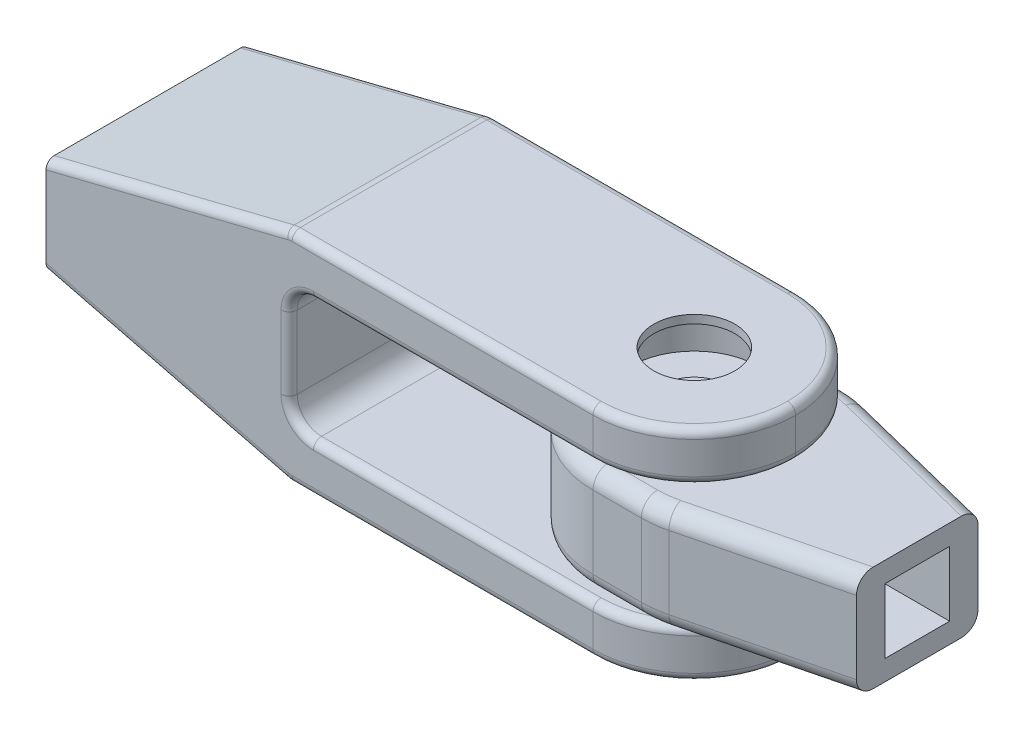
from build123d import *
from build123d.topology import SkipClean

# Parameters (mm, degrees)
BOSS_EXTRUDE1_DEPTH     = 12.5
FILLET1_R               = 12.5
FILLET2_R               = 3
SKETCH2_W               = 8
SKETCH2_H               = 8
CUT_EXTRUDE1_DEPTH      = 20
SKETCH3_R               = 7.9375
CUT_EXTRUDE2_DEPTH      = 12.47904
CUT_EXTRUDE3_DEPTH      = 54.27757502
CUT_EXTRUDE3_DEPTH_BACK = 54.27757502
SKETCH4_R               = 5
SKETCH5_W               = 40
SKETCH5_H               = 13
BOSS_EXTRUDE2_DEPTH     = 12.5
FILLET4_R               = 12.5
CUT_EXTRUDE4_DEPTH      = 70.14658343
CUT_EXTRUDE4_DEPTH_BACK = 70.14658343
SKETCH7_R               = 2.5
SKETCH9_W               = 8
SKETCH9_H               = 8
CUT_EXTRUDE5_DEPTH      = 20
SKETCH10_R              = 4
SKETCH10_R_2            = 2.5
BOSS_EXTRUDE3_DEPTH     = 7.5
FILLET5_R               = 12.5
FILLET6_R               = 2
FILLET3_R               = 1


with BuildPart() as part:
    # Sketch1 → Boss-Extrude1 (new, symmetric)
    with BuildSketch(Plane.XY):
        Polygon((0, 13.5), (50, 13.5), (50, 7.5), (0, 7.5), (0, -7.5), (50, -7.5), (50, -13.5), (0, -13.5), (-30, -6), (-30, 6), align=None)
    extrude(amount=BOSS_EXTRUDE1_DEPTH, both=True)

    # Fillet1
    fillet1_edges = [part.edges().sort_by_distance(p)[0] for p in [
        (50, -10.5, -12.5),
        (50, -10.5, 12.5),
        (50, 10.5, -12.5),
        (50, 10.5, 12.5),
    ]]
    fillet(fillet1_edges, radius=FILLET1_R - 0.0001)  # a hair under: the kernel refuses the full size

    # Fillet2
    fillet2_edges = [part.edges().sort_by_distance(p)[0] for p in [
        (0, -13.5, 0),
        (0, -7.5, 0),
        (0, 7.5, 0),
        (0, 13.5, 0),
    ]]
    fillet(fillet2_edges, radius=FILLET2_R)

    # Sketch2 → Cut-Extrude1 (cut)
    with BuildSketch(Plane.ZY.offset(30)):
        Rectangle(SKETCH2_W, SKETCH2_H)
    extrude(amount=-CUT_EXTRUDE1_DEPTH, mode=Mode.SUBTRACT)

    # Sketch3 → Cut-Extrude2 (cut, symmetric)
    with BuildSketch(Plane(origin=(0, 0, 0), x_dir=(1, 0, 0), z_dir=(0, 1, 0))):
        with Locations(Location((37.5, 0, 0), (0, 0, 270))):
            Circle(SKETCH3_R)
    extrude(amount=CUT_EXTRUDE2_DEPTH, both=True, mode=Mode.SUBTRACT)

    # Sketch4 → Cut-Extrude3 (cut, two sides: drawn at the far end of the back side and taken through both)
    with BuildSketch(Plane(origin=(0, 0, 0), x_dir=(1, 0, 0), z_dir=(0, 1, 0)).offset(-CUT_EXTRUDE3_DEPTH_BACK)):
        with Locations(Location((37.5, 0, 0), (0, 0, 270))):
            Circle(SKETCH4_R)
    extrude(amount=CUT_EXTRUDE3_DEPTH + CUT_EXTRUDE3_DEPTH_BACK, mode=Mode.SUBTRACT)

    # Fillet3
    fillet3_edges = [part.edges().sort_by_distance(p)[0] for p in [
        (-15.179144999, 9.70521375, -12.5),
        (20.25005, 7.5, -12.5),
        (18.934708438, -13.5, -12.5),
        (18.934708438, -13.5, 12.5),
        (46.338864054, -13.5, 8.838864054),
        (46.338864054, -13.5, -8.838864054),
        (46.338864054, -7.5, 8.838864054),
        (46.338864054, -7.5, -8.838864054),
        (20.25005, 7.5, 12.5),
        (46.338864054, 7.5, 8.838864054),
        (46.338864054, 7.5, -8.838864054),
        (46.338864054, 13.5, 8.838864054),
        (46.338864054, 13.5, -8.838864054),
        (20.25005, -7.5, -12.5),
        (-15.179144999, -9.70521375, -12.5),
        (18.934708438, 13.5, -12.5),
        (0, 0, -12.5),
        (0.002767086, 13.47752267, -12.5),
        (0.002767086, -13.47752267, -12.5),
        (-15.179144999, -9.70521375, 12.5),
        (20.25005, -7.5, 12.5),
        (0, 0, 12.5),
        (18.934708438, 13.5, 12.5),
        (0.002767086, 13.47752267, 12.5),
        (0.002767086, -13.47752267, 12.5),
        (0.878679656, -6.621320344, -12.5),
        (0.878679656, -6.621320344, 12.5),
        (0.878679656, 6.621320344, -12.5),
        (0.878679656, 6.621320344, 12.5),
        (-15.179144999, 9.70521375, 12.5),
    ]]
    fillet(fillet3_edges, radius=FILLET3_R)


with BuildPart() as body_2:
    # Sketch5 → Boss-Extrude2 (new, symmetric)
    with BuildSketch(Plane.XY):
        with Locations((45, 0)):
            Rectangle(SKETCH5_W, SKETCH5_H)
    extrude(amount=BOSS_EXTRUDE2_DEPTH, both=True)

    # Fillet4
    fillet4_edges = [body_2.edges().sort_by_distance(p)[0] for p in [
        (25, 0, 12.5),
        (25, 0, -12.5),
    ]]
    fillet(fillet4_edges, radius=FILLET4_R - 0.0001)  # a hair under: the kernel refuses the full size

    # Sketch7 → Cut-Extrude4 (cut, two sides: drawn at the far end of the back side and taken through both)
    with BuildSketch(Plane(origin=(0, 6.5, 0), x_dir=(1, 0, 0), z_dir=(0, 1, 0)).offset(-CUT_EXTRUDE4_DEPTH_BACK)):
        with Locations(Location((37.5, 0, 0), (0, 0, 270))):
            Circle(SKETCH7_R)
        Polygon((45, 12.5), (65, 7.5), (65, 12.5), align=None)
        Polygon((65, -7.5), (65, -12.5), (45, -12.5), align=None)
    extrude(amount=CUT_EXTRUDE4_DEPTH + CUT_EXTRUDE4_DEPTH_BACK, mode=Mode.SUBTRACT)

    # Sketch9 → Cut-Extrude5 (cut)
    with BuildSketch(Plane(origin=(65, 0, 0), x_dir=(0, 0, -1), z_dir=(1, 0, 0))):
        Rectangle(SKETCH9_W, SKETCH9_H)
    extrude(amount=-CUT_EXTRUDE5_DEPTH, mode=Mode.SUBTRACT)

    # Sketch10 → Boss-Extrude3 (add, symmetric)
    with SkipClean():  # the faces are left unmerged after this step: merging them gives an invalid solid
        with BuildSketch(Plane.XZ):
            with Locations(Location((37.5, 0, 0), (0, 0, 270))):
                Circle(SKETCH10_R)
            with Locations(Location((37.5, 0, 0), (0, 0, 270))):
                Circle(SKETCH10_R_2, mode=Mode.SUBTRACT)
        extrude(amount=BOSS_EXTRUDE3_DEPTH, both=True)

    # Fillet5
    fillet5_edges = [body_2.edges().sort_by_distance(p)[0] for p in [
        (45, 0, -12.5),
        (45, 0, 12.5),
    ]]
    fillet(fillet5_edges, radius=FILLET5_R)

    # Fillet6
    fillet6_edges = [body_2.edges().sort_by_distance(p)[0] for p in [
        (40.48053984, -6.5, 12.5),
        (40.48053984, -6.5, -12.5),
        (28.661135946, -6.5, -8.838864054),
        (28.661135946, -6.5, 8.838864054),
        (28.661135946, 6.5, -8.838864054),
        (28.661135946, 6.5, 8.838864054),
        (55.746437496, 6.5, -9.813390626),
        (55.746437496, -6.5, 9.813390626),
        (55.746437496, 6.5, 9.813390626),
        (55.746437496, -6.5, -9.813390626),
        (44.988470476, -6.5, -12.406344459),
        (44.988470476, -6.5, 12.406344459),
        (40.48053984, 6.5, 12.5),
        (40.48053984, 6.5, -12.5),
        (44.988470476, 6.5, -12.406344459),
        (44.988470476, 6.5, 12.406344459),
    ]]
    fillet(fillet6_edges, radius=FILLET6_R)


solid = Compound([part.part, body_2.part])
